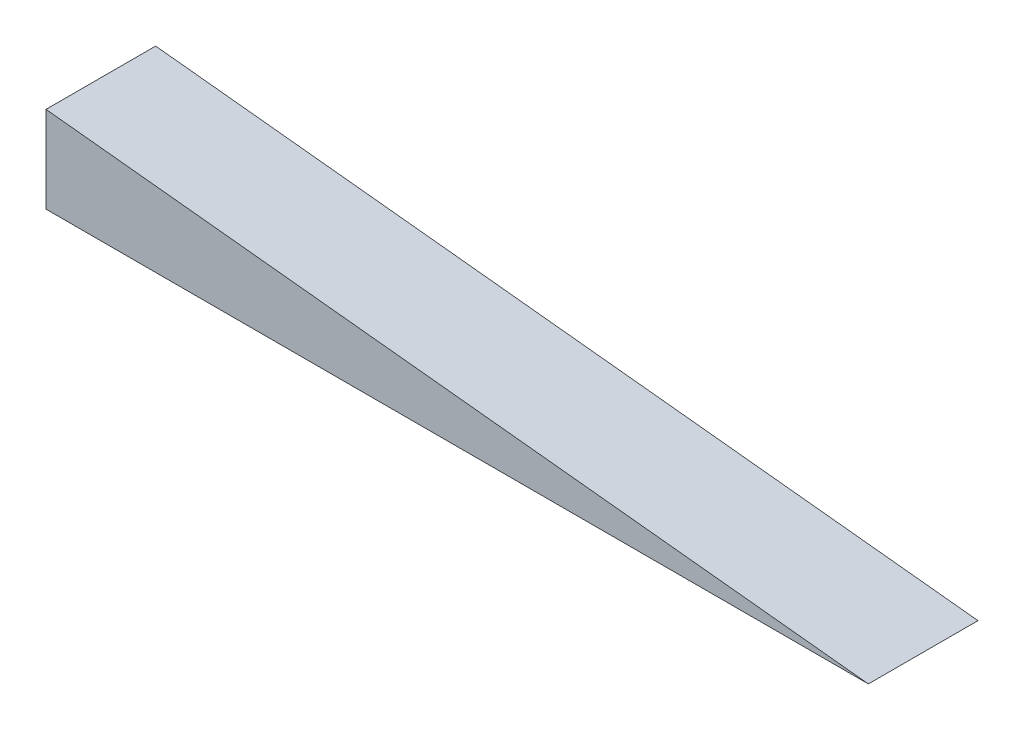
from build123d import *

# Parameters (mm, degrees)
BOSS_EXTRUDE1_DEPTH = 10


with BuildPart() as part:
    # Sketch1 → Boss-Extrude1 (new, symmetric)
    with BuildSketch(Plane.XY):
        Polygon((-50.147680837, 0), (99.852319163, 0), (-50.147680837, 15.76563529), align=None)
    extrude(amount=BOSS_EXTRUDE1_DEPTH, both=True)


solid = part.part
